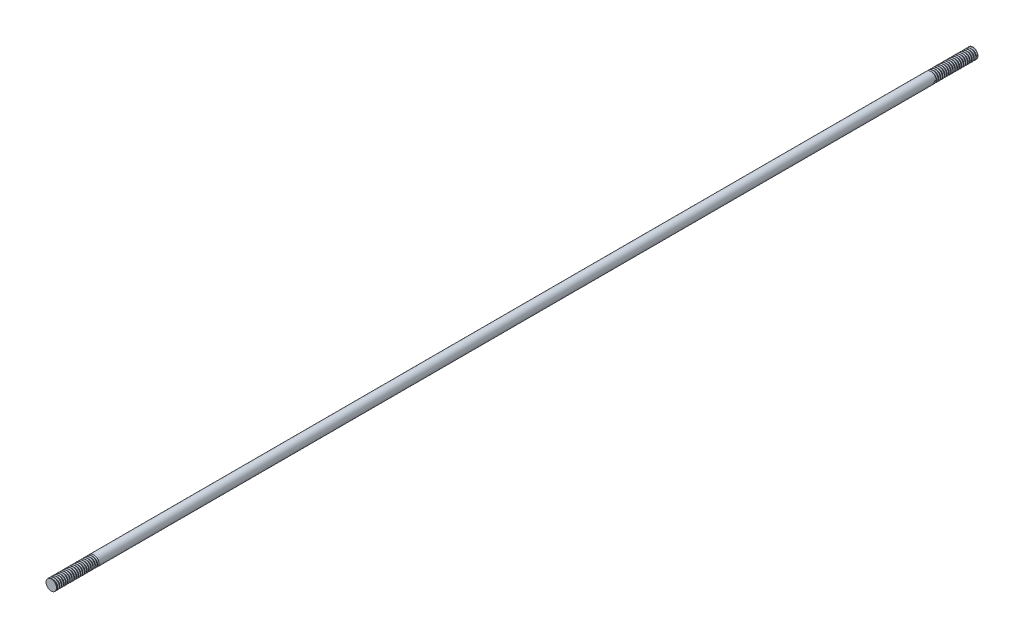
from build123d import *
from build123d.topology import SkipClean

# Parameters (mm, degrees)
SKETCH1_R           = 3.175
BOSS_EXTRUDE1_DEPTH = 558.3149
THREAD2_PITCH       = 1.27
THREAD3_PITCH       = 1.27


with BuildPart() as part:
    # Sketch1 → Boss-Extrude1 (new body)
    with BuildSketch(Plane.XY):
        Circle(SKETCH1_R)
    extrude(amount=BOSS_EXTRUDE1_DEPTH)

    # Thread2: the profile of Thread Profile1 profile screwed along a right-hand helix of 20 turns, 8 arcs to a turn; built about Z, then put on its axis
    with SkipClean():  # the faces are left unmerged after this step: merging them gives an invalid solid
        thread2_z = Axis((0, 0, 0), (0, 0, 1))
        thread2_corners = [(3.1753, -1e-09, -0.000173205), (3.1753, -1e-09, 1.111423202), (2.487592339, -1e-09, 0.714374998), (2.487592339, -1e-09, 0.396874998)]
        with BuildLine(mode=Mode.PRIVATE) as thread2_profile:
            Line(thread2_corners[0], thread2_corners[1])
            Line(thread2_corners[1], thread2_corners[2])
            Line(thread2_corners[2], thread2_corners[3])
            Line(thread2_corners[3], thread2_corners[0])
        thread2_cap = Face(thread2_profile.wire())
        thread2_turn_angles = [0, 22.5, 45, 67.5, 90, 112.5, 135, 157.5, 180, 202.5, 225, 247.5, 270, 292.5, 315, 337.5, 360]
        thread2_turn_weights = [1, 0.9238795325112867, 1, 0.9238795325112867, 1, 0.9238795325112867, 1, 0.9238795325112867, 1, 0.9238795325112867, 1, 0.9238795325112867, 1, 0.9238795325112867, 1, 0.9238795325112867, 1]
        thread2_turn_rails = [Edge.make_bspline([Vector(p[0], p[1], 0).rotate(thread2_z, thread2_turn_angles[k]) / thread2_turn_weights[k] + Vector(0, 0, p[2] + THREAD2_PITCH * thread2_turn_angles[k] / 360) for k in range(17)], [0, 0, 0, 1, 1, 2, 2, 3, 3, 4, 4, 5, 5, 6, 6, 7, 7, 8, 8, 8], 2, thread2_turn_weights) for p in thread2_corners]
        thread2_turn_sides = [Face.make_surface_from_curves(thread2_turn_rails[p[0]], thread2_turn_rails[p[1]]) for p in [(0, 1), (1, 2), (2, 3), (3, 0)]]
        thread2 = Plane(origin=(0, 0, 0), x_dir=(0.999390827, 0.034899497, 0), z_dir=(0, 0, 1)) * Solid(Shell([*[p.moved(Location((0, 0, THREAD2_PITCH * i))) for i in range(20) for p in thread2_turn_sides], thread2_cap, thread2_cap.rotate(thread2_z, 7200).moved(Location((0, 0, THREAD2_PITCH * 7200 / 360)))]))
        add(thread2, mode=Mode.SUBTRACT)

    # Thread3: the profile of Thread Profile2 profile screwed along a right-hand helix of 20 turns, 8 arcs to a turn; built about Z, then put on its axis
    with SkipClean():  # the faces are left unmerged after this step: merging them gives an invalid solid
        thread3_z = Axis((0, 0, 0), (0, 0, 1))
        thread3_corners = [(3.1753, -1e-09, -0.000173205), (3.1753, -1e-09, 1.111423202), (2.487592339, -1e-09, 0.714374998), (2.487592339, -1e-09, 0.396874998)]
        with BuildLine(mode=Mode.PRIVATE) as thread3_profile:
            Line(thread3_corners[0], thread3_corners[1])
            Line(thread3_corners[1], thread3_corners[2])
            Line(thread3_corners[2], thread3_corners[3])
            Line(thread3_corners[3], thread3_corners[0])
        thread3_cap = Face(thread3_profile.wire())
        thread3_turn_angles = [0, 22.5, 45, 67.5, 90, 112.5, 135, 157.5, 180, 202.5, 225, 247.5, 270, 292.5, 315, 337.5, 360]
        thread3_turn_weights = [1, 0.9238795325112867, 1, 0.9238795325112867, 1, 0.9238795325112867, 1, 0.9238795325112867, 1, 0.9238795325112867, 1, 0.9238795325112867, 1, 0.9238795325112867, 1, 0.9238795325112867, 1]
        thread3_turn_rails = [Edge.make_bspline([Vector(p[0], p[1], 0).rotate(thread3_z, thread3_turn_angles[k]) / thread3_turn_weights[k] + Vector(0, 0, p[2] + THREAD3_PITCH * thread3_turn_angles[k] / 360) for k in range(17)], [0, 0, 0, 1, 1, 2, 2, 3, 3, 4, 4, 5, 5, 6, 6, 7, 7, 8, 8, 8], 2, thread3_turn_weights) for p in thread3_corners]
        thread3_turn_sides = [Face.make_surface_from_curves(thread3_turn_rails[p[0]], thread3_turn_rails[p[1]]) for p in [(0, 1), (1, 2), (2, 3), (3, 0)]]
        thread3 = Plane(origin=(0, 0, 558.3149), x_dir=(-0.999390827, 0.034899497, 0), z_dir=(0, 0, -1)) * Solid(Shell([*[p.moved(Location((0, 0, THREAD3_PITCH * i))) for i in range(20) for p in thread3_turn_sides], thread3_cap, thread3_cap.rotate(thread3_z, 7200).moved(Location((0, 0, THREAD3_PITCH * 7200 / 360)))]))
        add(thread3, mode=Mode.SUBTRACT)


solid = part.part
